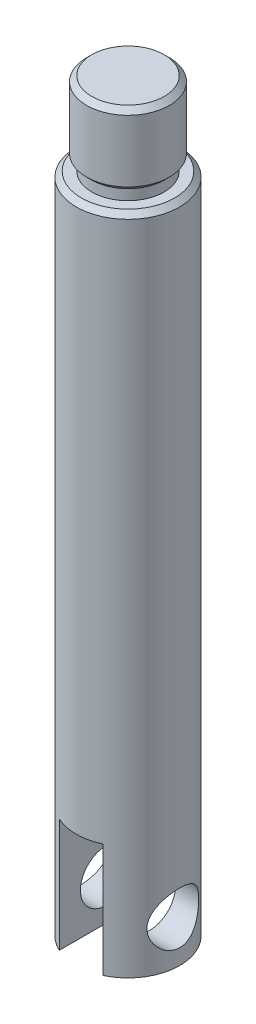
from build123d import *

# Parameters (mm, degrees)
SKETCH1_R           = 2
BOSS_EXTRUDE1_DEPTH = 3.5
CHAMFER1_SIZE       = 0.25
SKETCH2_R           = 1.75
BOSS_EXTRUDE2_DEPTH = 0.5
SKETCH3_R           = 2.5
BOSS_EXTRUDE3_DEPTH = 32
CHAMFER2_SIZE       = 0.25
SKETCH4_R           = 1.25
CUT_EXTRUDE3_DEPTH  = 4.25
SKETCH5_W           = 2.1
SKETCH5_H           = 5.195974672
CUT_EXTRUDE4_DEPTH  = 5.5


with BuildPart() as part:
    # Sketch1 → Boss-Extrude1 (new body)
    with BuildSketch(Plane(origin=(0, 0, 0), x_dir=(1, 0, 0), z_dir=(0, 1, 0))):
        Circle(SKETCH1_R)
    extrude(amount=BOSS_EXTRUDE1_DEPTH)

    # Chamfer1
    chamfer1_edges = [part.edges().sort_by_distance(p)[0] for p in [
        (-2, 0, 0),
        (-2, 3.5, 0),
    ]]
    chamfer(chamfer1_edges, length=CHAMFER1_SIZE)

    # Sketch2 → Boss-Extrude2 (add)
    with BuildSketch(Plane.XZ):
        Circle(SKETCH2_R)
    extrude(amount=BOSS_EXTRUDE2_DEPTH)

    # Sketch3 → Boss-Extrude3 (add)
    with BuildSketch(Plane.XZ.offset(0.5)):
        Circle(SKETCH3_R)
    extrude(amount=BOSS_EXTRUDE3_DEPTH)

    # Chamfer2
    chamfer2_edges = [part.edges().sort_by_distance(p)[0] for p in [
        (-2.5, -0.5, 0),
    ]]
    chamfer(chamfer2_edges, length=CHAMFER2_SIZE)

    # Sketch4 → Cut-Extrude3 (cut, symmetric)
    with BuildSketch(Plane(origin=(0, 0, 0), x_dir=(0, 0, -1), z_dir=(1, 0, 0))):
        with Locations((0, -30.5)):
            Circle(SKETCH4_R)
    extrude(amount=CUT_EXTRUDE3_DEPTH, both=True, mode=Mode.SUBTRACT)

    # Sketch5 → Cut-Extrude4 (cut)
    with BuildSketch(Plane.XZ.offset(32.5)):
        Rectangle(SKETCH5_W, SKETCH5_H)
    extrude(amount=-CUT_EXTRUDE4_DEPTH, mode=Mode.SUBTRACT)


solid = part.part
